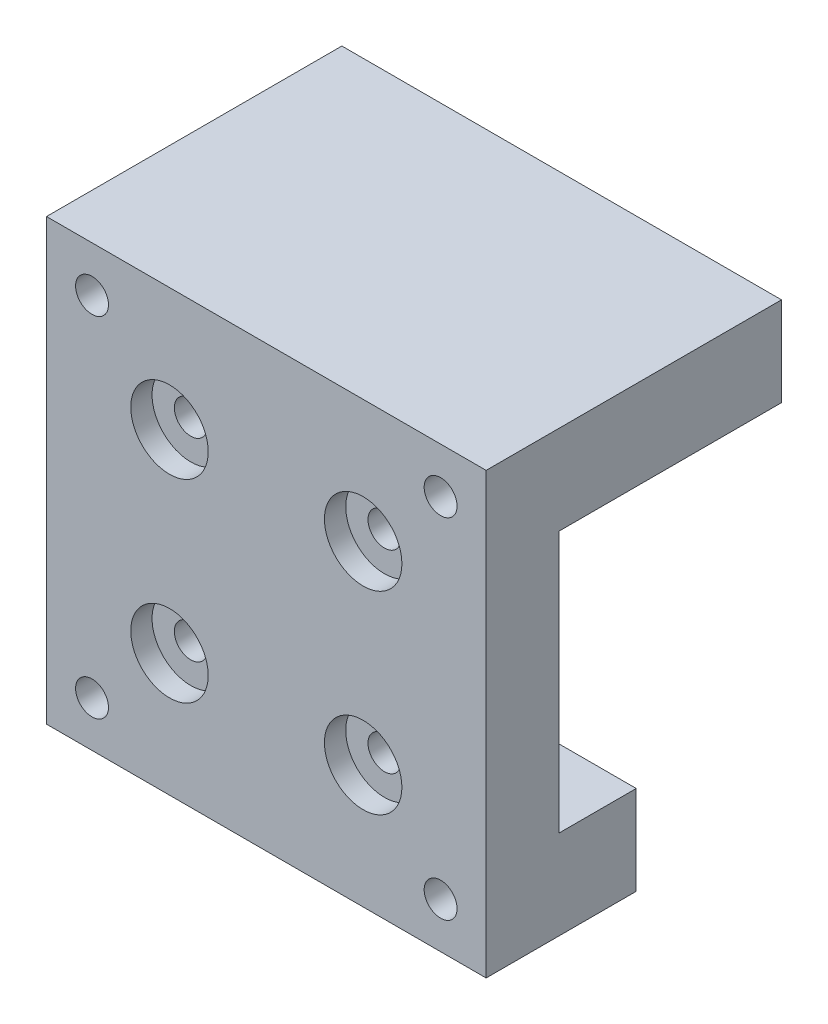
from build123d import *

# Parameters (mm, degrees)
SKETCH1_W           = 45.4
SKETCH1_H           = 45.4
BOSS_EXTRUDE1_DEPTH = 15.5
SKETCH2_W           = 45.4
SKETCH2_H           = 27
CUT_EXTRUDE1_DEPTH  = 8
SKETCH19_W          = 45.4
SKETCH19_H          = 9.2
BOSS_EXTRUDE2_DEPTH = 15
SKETCH15_R          = 1.7
CUT_EXTRUDE6_DEPTH  = 72.081432175
CUT_EXTRUDE4_REACH  = 73.081
SKETCH13_R          = 1.7
SKETCH16_R          = 3.5
CUT_EXTRUDE7_DEPTH  = 70.846760841
SKETCH17_R          = 4
CUT_EXTRUDE8_DEPTH  = 2.2
SKETCH18_R          = 1.35
CUT_EXTRUDE9_DEPTH  = 10


with BuildPart() as part:
    # Sketch1 → Boss-Extrude1 (new body)
    with BuildSketch(Plane.XY):
        with Locations((22.7, 22.7)):
            Rectangle(SKETCH1_W, SKETCH1_H)
    extrude(amount=BOSS_EXTRUDE1_DEPTH)

    # Sketch2 → Cut-Extrude1 (cut)
    with BuildSketch(Plane(origin=(0, 0, 0), x_dir=(-1, 0, 0), z_dir=(0, 0, -1))):
        with Locations((-22.7, 22.7)):
            Rectangle(SKETCH2_W, SKETCH2_H)
    extrude(amount=-CUT_EXTRUDE1_DEPTH, mode=Mode.SUBTRACT)

    # Sketch19 → Boss-Extrude2 (add)
    with BuildSketch(Plane(origin=(0, 0, 0), x_dir=(-1, 0, 0), z_dir=(0, 0, -1))):
        with Locations((-22.7, 40.8)):
            Rectangle(SKETCH19_W, SKETCH19_H)
    extrude(amount=BOSS_EXTRUDE2_DEPTH)

    # Sketch15 → Cut-Extrude6 (cut, through all)
    with BuildSketch(Plane(origin=(0, 0, 15.5), x_dir=(-1, 0, 0), z_dir=(0, 0, -1))):
        with Locations((-4.7, 40.7)):
            Circle(SKETCH15_R)
        with Locations((-40.7, 40.7)):
            Circle(SKETCH15_R)
        with Locations((-40.7, 4.7)):
            Circle(SKETCH15_R)
        with Locations((-4.7, 4.7)):
            Circle(SKETCH15_R)
    extrude(amount=CUT_EXTRUDE6_DEPTH, mode=Mode.SUBTRACT)

    # Sketch13 → Cut-Extrude4 (cut, up to next)
    with BuildSketch(Plane.XY.offset(15.5), mode=Mode.PRIVATE) as cut_extrude4_sk1:
        with Locations((32.7, 32.7)):
            Circle(SKETCH13_R)
    cut_extrude4_tool1 = extrude(cut_extrude4_sk1.sketch, amount=-CUT_EXTRUDE4_REACH, mode=Mode.PRIVATE) & part.part
    # Sketch13 → Cut-Extrude4 (cut, up to next)
    with BuildSketch(Plane.XY.offset(15.5), mode=Mode.PRIVATE) as cut_extrude4_sk2:
        with Locations((12.7, 32.7)):
            Circle(SKETCH13_R)
    cut_extrude4_tool2 = extrude(cut_extrude4_sk2.sketch, amount=-CUT_EXTRUDE4_REACH, mode=Mode.PRIVATE) & part.part
    # Sketch13 → Cut-Extrude4 (cut, up to next)
    with BuildSketch(Plane.XY.offset(15.5), mode=Mode.PRIVATE) as cut_extrude4_sk3:
        with Locations((32.7, 12.7)):
            Circle(SKETCH13_R)
    cut_extrude4_tool3 = extrude(cut_extrude4_sk3.sketch, amount=-CUT_EXTRUDE4_REACH, mode=Mode.PRIVATE) & part.part
    # Sketch13 → Cut-Extrude4 (cut, up to next)
    with BuildSketch(Plane.XY.offset(15.5), mode=Mode.PRIVATE) as cut_extrude4_sk4:
        with Locations((12.7, 12.7)):
            Circle(SKETCH13_R)
    cut_extrude4_tool4 = extrude(cut_extrude4_sk4.sketch, amount=-CUT_EXTRUDE4_REACH, mode=Mode.PRIVATE) & part.part
    add(cut_extrude4_tool1.solids().sort_by_distance((32.7, 32.7, 15.5))[0], mode=Mode.SUBTRACT)
    add(cut_extrude4_tool2.solids().sort_by_distance((12.7, 32.7, 15.5))[0], mode=Mode.SUBTRACT)
    add(cut_extrude4_tool3.solids().sort_by_distance((32.7, 12.7, 15.5))[0], mode=Mode.SUBTRACT)
    add(cut_extrude4_tool4.solids().sort_by_distance((12.7, 12.7, 15.5))[0], mode=Mode.SUBTRACT)

    # Sketch16 → Cut-Extrude7 (cut, through all)
    with BuildSketch(Plane.XY.offset(12.5)):
        with Locations((4.7, 40.7)):
            Circle(SKETCH16_R)
        with Locations((40.7, 40.7)):
            Circle(SKETCH16_R)
        with Locations((40.7, 4.7)):
            Circle(SKETCH16_R)
        with Locations((4.7, 4.7)):
            Circle(SKETCH16_R)
    extrude(amount=-CUT_EXTRUDE7_DEPTH, mode=Mode.SUBTRACT)

    # Sketch17 → Cut-Extrude8 (cut)
    with BuildSketch(Plane.XY.offset(15.5)):
        with Locations((12.7, 32.7)):
            Circle(SKETCH17_R)
        with Locations((32.7, 32.7)):
            Circle(SKETCH17_R)
        with Locations((32.7, 12.7)):
            Circle(SKETCH17_R)
        with Locations((12.7, 12.7)):
            Circle(SKETCH17_R)
    extrude(amount=-CUT_EXTRUDE8_DEPTH, mode=Mode.SUBTRACT)

    # Sketch18 → Cut-Extrude9 (cut)
    with BuildSketch(Plane(origin=(0, 0, 0), x_dir=(-1, 0, 0), z_dir=(0, 0, -1))):
        with Locations((-32.4, 4.6)):
            Circle(SKETCH18_R)
        with Locations((-13, 4.6)):
            Circle(SKETCH18_R)
    extrude(amount=-CUT_EXTRUDE9_DEPTH, mode=Mode.SUBTRACT)


solid = part.part
